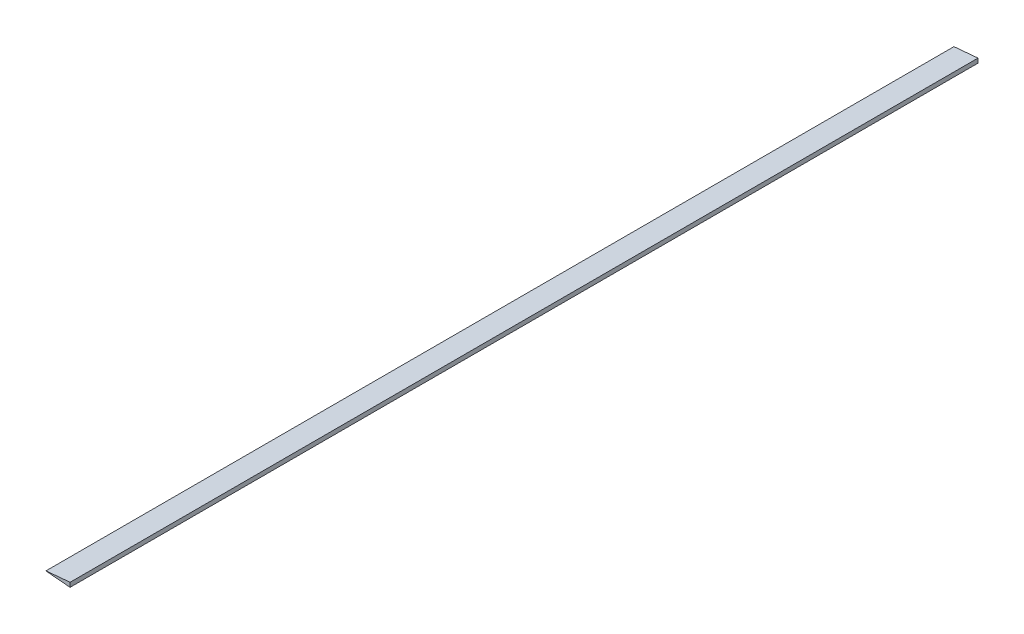
from build123d import *

# Parameters (mm, degrees)
BOSS_EXTRUDE1_DEPTH = 427.7


with BuildPart() as part:
    # Sketch1 → Boss-Extrude1 (new, symmetric)
    with BuildSketch(Plane.XY):
        with BuildLine():
            Line((-52.9207, 2.07684466), (-52.9207, -2.07684466))
            add(Edge.make_bspline(
                [(-52.9207, -2.07684466), (-53.005583768, -2.070855217), (-54.26604225, -1.98191662), (-56.632245243, -1.79867102), (-59.938504784, -1.534709576), (-63.002089532, -1.275526228), (-65.789589679, -1.029143381), (-68.2704244, -0.800692397), (-70.417422257, -0.595796619), (-72.207061645, -0.419650045), (-73.619742672, -0.27702713), (-74.639993581, -0.171969436), (-75.256648567, -0.107641711), (-75.53197545, -0.078698915), (-75.601, -0.071442945)],
                knots=[0, 0, 0, 0, 0.011211572, 0.166483201, 0.31268616, 0.448210553, 0.571562716, 0.681381362, 0.776452467, 0.855722863, 0.918312437, 0.963524724, 0.990855635, 1, 1, 1, 1], degree=3))
            Line((-75.601, -0.071442945), (-75.601, 0.071442945))
            add(Edge.make_bspline(
                [(-52.9207, 2.07684466), (-53.005583768, 2.070855217), (-54.26604225, 1.98191662), (-56.632245243, 1.79867102), (-59.938504784, 1.534709576), (-63.002089532, 1.275526228), (-65.789589679, 1.029143381), (-68.2704244, 0.800692397), (-70.417422257, 0.595796619), (-72.207061645, 0.419650045), (-73.619742672, 0.27702713), (-74.639993581, 0.171969436), (-75.256648567, 0.107641711), (-75.53197545, 0.078698915), (-75.601, 0.071442945)],
                knots=[0, 0, 0, 0, 0.011211572, 0.166483201, 0.31268616, 0.448210553, 0.571562716, 0.681381362, 0.776452467, 0.855722863, 0.918312437, 0.963524724, 0.990855635, 1, 1, 1, 1], degree=3))
        make_face()
    extrude(amount=BOSS_EXTRUDE1_DEPTH, both=True)


solid = part.part
